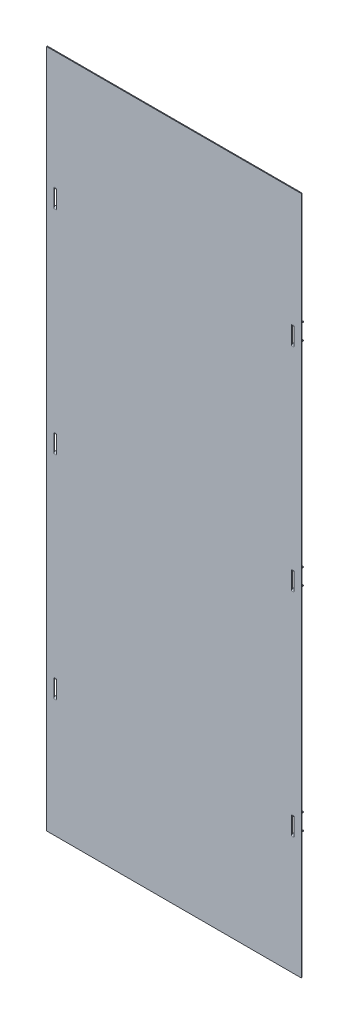
from build123d import *

# Parameters (mm, degrees)
SKETCH1_W                       = 300
SKETCH1_H                       = 800
BOSS_EXTRUDE1_DEPTH             = 1
SKETCH2_W                       = 3
SKETCH2_H                       = 20
CUT_EXTRUDE1_DEPTH              = 10
EDGE_FLANGE1_STRIP_W            = 6
EDGE_FLANGE1_STRIP_H            = 1
EDGE_FLANGE1_STRIP_CUT_DEPTH    = 3
EDGE_FLANGE1_STRIP_2_W          = 6
EDGE_FLANGE1_STRIP_2_H          = 1
EDGE_FLANGE1_STRIP_CUT_2_DEPTH  = 3
EDGE_FLANGE1_STRIP_3_W          = 6
EDGE_FLANGE1_STRIP_3_H          = 1
EDGE_FLANGE1_STRIP_CUT_3_DEPTH  = 3
EDGE_FLANGE1_STRIP_4_W          = 6
EDGE_FLANGE1_STRIP_4_H          = 1
EDGE_FLANGE1_STRIP_CUT_4_DEPTH  = 3
EDGE_FLANGE1_STRIP_5_W          = 6
EDGE_FLANGE1_STRIP_5_H          = 1
EDGE_FLANGE1_STRIP_CUT_5_DEPTH  = 3
EDGE_FLANGE1_STRIP_6_W          = 6
EDGE_FLANGE1_STRIP_6_H          = 1
EDGE_FLANGE1_STRIP_CUT_6_DEPTH  = 3
EDGE_FLANGE1_STRIP_7_W          = 6
EDGE_FLANGE1_STRIP_7_H          = 1
EDGE_FLANGE1_STRIP_CUT_7_DEPTH  = 3
EDGE_FLANGE1_STRIP_8_W          = 6
EDGE_FLANGE1_STRIP_8_H          = 1
EDGE_FLANGE1_STRIP_CUT_8_DEPTH  = 3
EDGE_FLANGE1_STRIP_9_W          = 6
EDGE_FLANGE1_STRIP_9_H          = 1
EDGE_FLANGE1_STRIP_CUT_9_DEPTH  = 3
EDGE_FLANGE1_STRIP_10_W         = 6
EDGE_FLANGE1_STRIP_10_H         = 1
EDGE_FLANGE1_STRIP_CUT_10_DEPTH = 3
EDGE_FLANGE1_STRIP_11_W         = 6
EDGE_FLANGE1_STRIP_11_H         = 1
EDGE_FLANGE1_STRIP_CUT_11_DEPTH = 3
EDGE_FLANGE1_STRIP_12_W         = 6
EDGE_FLANGE1_STRIP_12_H         = 1
EDGE_FLANGE1_STRIP_CUT_12_DEPTH = 3
EDGE_FLANGE1_DEPTH              = 3
EDGE_FLANGE1_BEND_DEPTH         = 3
EDGE_FLANGE1_BEND_2_DEPTH       = 3
EDGE_FLANGE1_BEND_3_DEPTH       = 3
EDGE_FLANGE1_BEND_4_DEPTH       = 3
EDGE_FLANGE1_BEND_5_DEPTH       = 3
EDGE_FLANGE1_BEND_6_DEPTH       = 3
EDGE_FLANGE1_BEND_7_DEPTH       = 3
EDGE_FLANGE1_BEND_8_DEPTH       = 3
EDGE_FLANGE1_BEND_9_DEPTH       = 3
EDGE_FLANGE1_BEND_10_DEPTH      = 3
EDGE_FLANGE1_BEND_11_DEPTH      = 3


# Sheet-metal steps are written as plain solids
with BuildPart() as part:
    # Sketch1 → Boss-Extrude1 (new body)
    with BuildSketch(Plane.XY):
        Rectangle(SKETCH1_W, SKETCH1_H)
    extrude(amount=BOSS_EXTRUDE1_DEPTH)

    # Sketch2 → Cut-Extrude1 (cut)
    with BuildSketch(Plane.XY.offset(1)):
        with Locations((-140, 250)):
            Rectangle(SKETCH2_W, SKETCH2_H)
        with Locations((140, 250)):
            Rectangle(SKETCH2_W, SKETCH2_H)
        with Locations((140, 0)):
            Rectangle(SKETCH2_W, SKETCH2_H)
        with Locations((140, -250)):
            Rectangle(SKETCH2_W, SKETCH2_H)
        with Locations((-140, 0)):
            Rectangle(SKETCH2_W, SKETCH2_H)
        with Locations((-140, -250)):
            Rectangle(SKETCH2_W, SKETCH2_H)
    extrude(amount=-CUT_EXTRUDE1_DEPTH, mode=Mode.SUBTRACT)

    # Edge-Flange1 strip (across the edge) → Edge-Flange1 strip cut (cut)
    with BuildSketch(Plane(origin=(-138.5, 260, 0), x_dir=(0, 1, 0), z_dir=(-1, 0, 0))):
        with Locations((-2, -0.5)):
            Rectangle(EDGE_FLANGE1_STRIP_W, EDGE_FLANGE1_STRIP_H)
    extrude(amount=EDGE_FLANGE1_STRIP_CUT_DEPTH, mode=Mode.SUBTRACT)

    # Edge-Flange1 strip 2 (across the edge) → Edge-Flange1 strip cut 2 (cut)
    with BuildSketch(Plane(origin=(-141.5, 240, 0), x_dir=(0, -1, 0), z_dir=(1, 0, 0))):
        with Locations((-2, -0.5)):
            Rectangle(EDGE_FLANGE1_STRIP_2_W, EDGE_FLANGE1_STRIP_2_H)
    extrude(amount=EDGE_FLANGE1_STRIP_CUT_2_DEPTH, mode=Mode.SUBTRACT)

    # Edge-Flange1 strip 3 (across the edge) → Edge-Flange1 strip cut 3 (cut)
    with BuildSketch(Plane(origin=(141.5, 260, 0), x_dir=(0, 1, 0), z_dir=(-1, 0, 0))):
        with Locations((-2, -0.5)):
            Rectangle(EDGE_FLANGE1_STRIP_3_W, EDGE_FLANGE1_STRIP_3_H)
    extrude(amount=EDGE_FLANGE1_STRIP_CUT_3_DEPTH, mode=Mode.SUBTRACT)

    # Edge-Flange1 strip 4 (across the edge) → Edge-Flange1 strip cut 4 (cut)
    with BuildSketch(Plane(origin=(138.5, 240, 0), x_dir=(0, -1, 0), z_dir=(1, 0, 0))):
        with Locations((-2, -0.5)):
            Rectangle(EDGE_FLANGE1_STRIP_4_W, EDGE_FLANGE1_STRIP_4_H)
    extrude(amount=EDGE_FLANGE1_STRIP_CUT_4_DEPTH, mode=Mode.SUBTRACT)

    # Edge-Flange1 strip 5 (across the edge) → Edge-Flange1 strip cut 5 (cut)
    with BuildSketch(Plane(origin=(-141.5, -10, 0), x_dir=(0, -1, 0), z_dir=(1, 0, 0))):
        with Locations((-2, -0.5)):
            Rectangle(EDGE_FLANGE1_STRIP_5_W, EDGE_FLANGE1_STRIP_5_H)
    extrude(amount=EDGE_FLANGE1_STRIP_CUT_5_DEPTH, mode=Mode.SUBTRACT)

    # Edge-Flange1 strip 6 (across the edge) → Edge-Flange1 strip cut 6 (cut)
    with BuildSketch(Plane(origin=(138.5, -10, 0), x_dir=(0, -1, 0), z_dir=(1, 0, 0))):
        with Locations((-2, -0.5)):
            Rectangle(EDGE_FLANGE1_STRIP_6_W, EDGE_FLANGE1_STRIP_6_H)
    extrude(amount=EDGE_FLANGE1_STRIP_CUT_6_DEPTH, mode=Mode.SUBTRACT)

    # Edge-Flange1 strip 7 (across the edge) → Edge-Flange1 strip cut 7 (cut)
    with BuildSketch(Plane(origin=(-141.5, -260, 0), x_dir=(0, -1, 0), z_dir=(1, 0, 0))):
        with Locations((-2, -0.5)):
            Rectangle(EDGE_FLANGE1_STRIP_7_W, EDGE_FLANGE1_STRIP_7_H)
    extrude(amount=EDGE_FLANGE1_STRIP_CUT_7_DEPTH, mode=Mode.SUBTRACT)

    # Edge-Flange1 strip 8 (across the edge) → Edge-Flange1 strip cut 8 (cut)
    with BuildSketch(Plane(origin=(138.5, -260, 0), x_dir=(0, -1, 0), z_dir=(1, 0, 0))):
        with Locations((-2, -0.5)):
            Rectangle(EDGE_FLANGE1_STRIP_8_W, EDGE_FLANGE1_STRIP_8_H)
    extrude(amount=EDGE_FLANGE1_STRIP_CUT_8_DEPTH, mode=Mode.SUBTRACT)

    # Edge-Flange1 strip 9 (across the edge) → Edge-Flange1 strip cut 9 (cut)
    with BuildSketch(Plane(origin=(141.5, -240, 0), x_dir=(0, 1, 0), z_dir=(-1, 0, 0))):
        with Locations((-2, -0.5)):
            Rectangle(EDGE_FLANGE1_STRIP_9_W, EDGE_FLANGE1_STRIP_9_H)
    extrude(amount=EDGE_FLANGE1_STRIP_CUT_9_DEPTH, mode=Mode.SUBTRACT)

    # Edge-Flange1 strip 10 (across the edge) → Edge-Flange1 strip cut 10 (cut)
    with BuildSketch(Plane(origin=(141.5, 10, 0), x_dir=(0, 1, 0), z_dir=(-1, 0, 0))):
        with Locations((-2, -0.5)):
            Rectangle(EDGE_FLANGE1_STRIP_10_W, EDGE_FLANGE1_STRIP_10_H)
    extrude(amount=EDGE_FLANGE1_STRIP_CUT_10_DEPTH, mode=Mode.SUBTRACT)

    # Edge-Flange1 strip 11 (across the edge) → Edge-Flange1 strip cut 11 (cut)
    with BuildSketch(Plane(origin=(-138.5, 10, 0), x_dir=(0, 1, 0), z_dir=(-1, 0, 0))):
        with Locations((-2, -0.5)):
            Rectangle(EDGE_FLANGE1_STRIP_11_W, EDGE_FLANGE1_STRIP_11_H)
    extrude(amount=EDGE_FLANGE1_STRIP_CUT_11_DEPTH, mode=Mode.SUBTRACT)

    # Edge-Flange1 strip 12 (across the edge) → Edge-Flange1 strip cut 12 (cut)
    with BuildSketch(Plane(origin=(-138.5, -240, 0), x_dir=(0, 1, 0), z_dir=(-1, 0, 0))):
        with Locations((-2, -0.5)):
            Rectangle(EDGE_FLANGE1_STRIP_12_W, EDGE_FLANGE1_STRIP_12_H)
    extrude(amount=EDGE_FLANGE1_STRIP_CUT_12_DEPTH, mode=Mode.SUBTRACT)

    # Edge-Flange1 section (across the edge) → Edge-Flange1 (add)
    with BuildSketch(Plane(origin=(-138.5, 260, 0), x_dir=(0, 1, 0), z_dir=(-1, 0, 0))):
        with BuildLine():
            Line((-1, 1), (-1, 10))
            Line((-1, 10), (0, 10))
            Line((0, 10), (0, 1))
            ThreePointArc((0, 1), (0.292893219, 0.292893219), (1, 0))
            Line((1, 0), (1, -1))
            ThreePointArc((1, -1), (-0.414213562, -0.414213562), (-1, 1))
        make_face()
    extrude(amount=EDGE_FLANGE1_DEPTH)

    # Edge-Flange1 section 2 (across the edge) → Edge-Flange1 bend (add)
    with BuildSketch(Plane(origin=(-141.5, 240, 0), x_dir=(0, -1, 0), z_dir=(1, 0, 0))):
        with BuildLine():
            Line((-1, 1), (-1, 10))
            Line((-1, 10), (0, 10))
            Line((0, 10), (0, 1))
            ThreePointArc((0, 1), (0.292893219, 0.292893219), (1, 0))
            Line((1, 0), (1, -1))
            ThreePointArc((1, -1), (-0.414213562, -0.414213562), (-1, 1))
        make_face()
    extrude(amount=EDGE_FLANGE1_BEND_DEPTH)

    # Edge-Flange1 section 3 (across the edge) → Edge-Flange1 bend 2 (add)
    with BuildSketch(Plane(origin=(141.5, 260, 0), x_dir=(0, 1, 0), z_dir=(-1, 0, 0))):
        with BuildLine():
            Line((-1, 1), (-1, 10))
            Line((-1, 10), (0, 10))
            Line((0, 10), (0, 1))
            ThreePointArc((0, 1), (0.292893219, 0.292893219), (1, 0))
            Line((1, 0), (1, -1))
            ThreePointArc((1, -1), (-0.414213562, -0.414213562), (-1, 1))
        make_face()
    extrude(amount=EDGE_FLANGE1_BEND_2_DEPTH)

    # Edge-Flange1 section 4 (across the edge) → Edge-Flange1 bend 3 (add)
    with BuildSketch(Plane(origin=(138.5, 240, 0), x_dir=(0, -1, 0), z_dir=(1, 0, 0))):
        with BuildLine():
            Line((-1, 1), (-1, 10))
            Line((-1, 10), (0, 10))
            Line((0, 10), (0, 1))
            ThreePointArc((0, 1), (0.292893219, 0.292893219), (1, 0))
            Line((1, 0), (1, -1))
            ThreePointArc((1, -1), (-0.414213562, -0.414213562), (-1, 1))
        make_face()
    extrude(amount=EDGE_FLANGE1_BEND_3_DEPTH)

    # Edge-Flange1 section 5 (across the edge) → Edge-Flange1 bend 4 (add)
    with BuildSketch(Plane(origin=(-141.5, -10, 0), x_dir=(0, -1, 0), z_dir=(1, 0, 0))):
        with BuildLine():
            Line((-1, 1), (-1, 10))
            Line((-1, 10), (0, 10))
            Line((0, 10), (0, 1))
            ThreePointArc((0, 1), (0.292893219, 0.292893219), (1, 0))
            Line((1, 0), (1, -1))
            ThreePointArc((1, -1), (-0.414213562, -0.414213562), (-1, 1))
        make_face()
    extrude(amount=EDGE_FLANGE1_BEND_4_DEPTH)

    # Edge-Flange1 section 6 (across the edge) → Edge-Flange1 bend 5 (add)
    with BuildSketch(Plane(origin=(138.5, -10, 0), x_dir=(0, -1, 0), z_dir=(1, 0, 0))):
        with BuildLine():
            Line((-1, 1), (-1, 10))
            Line((-1, 10), (0, 10))
            Line((0, 10), (0, 1))
            ThreePointArc((0, 1), (0.292893219, 0.292893219), (1, 0))
            Line((1, 0), (1, -1))
            ThreePointArc((1, -1), (-0.414213562, -0.414213562), (-1, 1))
        make_face()
    extrude(amount=EDGE_FLANGE1_BEND_5_DEPTH)

    # Edge-Flange1 section 7 (across the edge) → Edge-Flange1 bend 6 (add)
    with BuildSketch(Plane(origin=(-141.5, -260, 0), x_dir=(0, -1, 0), z_dir=(1, 0, 0))):
        with BuildLine():
            Line((-1, 1), (-1, 10))
            Line((-1, 10), (0, 10))
            Line((0, 10), (0, 1))
            ThreePointArc((0, 1), (0.292893219, 0.292893219), (1, 0))
            Line((1, 0), (1, -1))
            ThreePointArc((1, -1), (-0.414213562, -0.414213562), (-1, 1))
        make_face()
    extrude(amount=EDGE_FLANGE1_BEND_6_DEPTH)

    # Edge-Flange1 section 8 (across the edge) → Edge-Flange1 bend 7 (add)
    with BuildSketch(Plane(origin=(138.5, -260, 0), x_dir=(0, -1, 0), z_dir=(1, 0, 0))):
        with BuildLine():
            Line((-1, 1), (-1, 10))
            Line((-1, 10), (0, 10))
            Line((0, 10), (0, 1))
            ThreePointArc((0, 1), (0.292893219, 0.292893219), (1, 0))
            Line((1, 0), (1, -1))
            ThreePointArc((1, -1), (-0.414213562, -0.414213562), (-1, 1))
        make_face()
    extrude(amount=EDGE_FLANGE1_BEND_7_DEPTH)

    # Edge-Flange1 section 9 (across the edge) → Edge-Flange1 bend 8 (add)
    with BuildSketch(Plane(origin=(141.5, -240, 0), x_dir=(0, 1, 0), z_dir=(-1, 0, 0))):
        with BuildLine():
            Line((-1, 1), (-1, 10))
            Line((-1, 10), (0, 10))
            Line((0, 10), (0, 1))
            ThreePointArc((0, 1), (0.292893219, 0.292893219), (1, 0))
            Line((1, 0), (1, -1))
            ThreePointArc((1, -1), (-0.414213562, -0.414213562), (-1, 1))
        make_face()
    extrude(amount=EDGE_FLANGE1_BEND_8_DEPTH)

    # Edge-Flange1 section 10 (across the edge) → Edge-Flange1 bend 9 (add)
    with BuildSketch(Plane(origin=(141.5, 10, 0), x_dir=(0, 1, 0), z_dir=(-1, 0, 0))):
        with BuildLine():
            Line((-1, 1), (-1, 10))
            Line((-1, 10), (0, 10))
            Line((0, 10), (0, 1))
            ThreePointArc((0, 1), (0.292893219, 0.292893219), (1, 0))
            Line((1, 0), (1, -1))
            ThreePointArc((1, -1), (-0.414213562, -0.414213562), (-1, 1))
        make_face()
    extrude(amount=EDGE_FLANGE1_BEND_9_DEPTH)

    # Edge-Flange1 section 11 (across the edge) → Edge-Flange1 bend 10 (add)
    with BuildSketch(Plane(origin=(-138.5, 10, 0), x_dir=(0, 1, 0), z_dir=(-1, 0, 0))):
        with BuildLine():
            Line((-1, 1), (-1, 10))
            Line((-1, 10), (0, 10))
            Line((0, 10), (0, 1))
            ThreePointArc((0, 1), (0.292893219, 0.292893219), (1, 0))
            Line((1, 0), (1, -1))
            ThreePointArc((1, -1), (-0.414213562, -0.414213562), (-1, 1))
        make_face()
    extrude(amount=EDGE_FLANGE1_BEND_10_DEPTH)

    # Edge-Flange1 section 12 (across the edge) → Edge-Flange1 bend 11 (add)
    with BuildSketch(Plane(origin=(-138.5, -240, 0), x_dir=(0, 1, 0), z_dir=(-1, 0, 0))):
        with BuildLine():
            Line((-1, 1), (-1, 10))
            Line((-1, 10), (0, 10))
            Line((0, 10), (0, 1))
            ThreePointArc((0, 1), (0.292893219, 0.292893219), (1, 0))
            Line((1, 0), (1, -1))
            ThreePointArc((1, -1), (-0.414213562, -0.414213562), (-1, 1))
        make_face()
    extrude(amount=EDGE_FLANGE1_BEND_11_DEPTH)


solid = part.part
